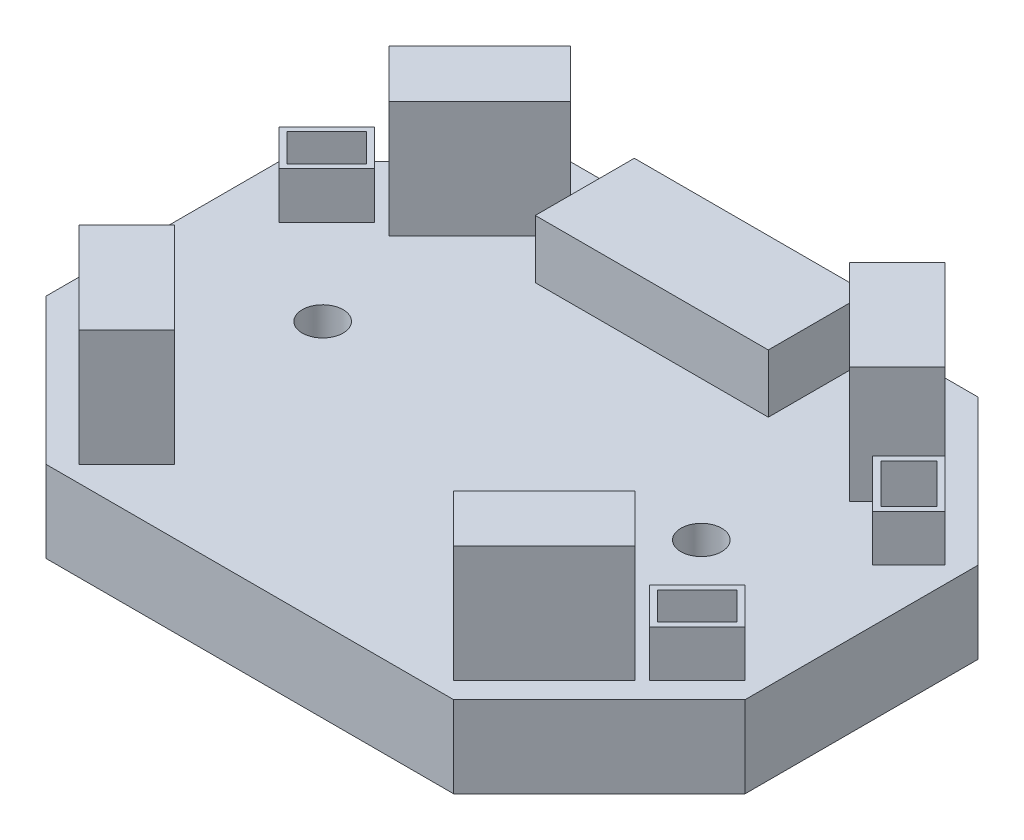
from build123d import *

# Parameters (mm, degrees)
SKETCH_1_R          = 1.75
SKETCH_1_W          = 20
SKETCH_1_H          = 8.5
EXTRUDE_1_DEPTH     = 7
EXTRUDE_2_DEPTH     = 17
EXTRUDE_3_DEPTH     = 11
SKETCH_1_4_W        = 20
SKETCH_1_4_H        = 8.5
EXTRUDE_4_DEPTH     = 12
SHELL_START         = 0.5
SHELL_4_OUTLINE_R   = 2.25
SHELL_4_DEPTH       = 6
SHELL_START_2       = 6.5
SHELL_4_2_DEPTH     = 10
SHELL_4_3_OUTLINE_W = 19
SHELL_4_3_OUTLINE_H = 8
SHELL_4_3_DEPTH     = 5


# Read off the part's stored shape, not the designer's step: 抽壳4
with BuildPart() as part:
    # 草图1 → 凸台-拉伸1 (new body)
    with BuildSketch(Plane(origin=(0, 0, 0), x_dir=(1, 0, 0), z_dir=(0, 1, 0))):
        Polygon((0, 0), (35, 0), (47.5, -12.5), (47.5, -32.5), (35, -45), (0, -45), (-12.5, -32.5), (-12.5, -12.5), align=None)
        with Locations(Location((33.75, -22.5, 0), (0, 0, 270))):
            Circle(SKETCH_1_R, mode=Mode.SUBTRACT)
        with Locations(Location((1.25, -22.5, 0), (0, 0, 90))):
            Circle(SKETCH_1_R, mode=Mode.SUBTRACT)
        Polygon((33.585786438, -43.585786438), (41.363961031, -35.807611845), (37.2627417, -31.706392514), (29.484567107, -39.484567107), align=None, mode=Mode.SUBTRACT)
        Polygon((46.085786438, -31.085786438), (41.984567107, -35.187005769), (38.87329727, -32.075735931), (42.9745166, -27.9745166), align=None, mode=Mode.SUBTRACT)
        Polygon((33.585786438, -1.414213562), (41.363961031, -9.192388155), (37.2627417, -13.293607486), (29.484567107, -5.515432893), align=None, mode=Mode.SUBTRACT)
        Polygon((46.085786438, -13.914213562), (41.984567107, -9.812994231), (38.87329727, -12.924264069), (42.9745166, -17.0254834), align=None, mode=Mode.SUBTRACT)
        Polygon((-7.9745166, -17.0254834), (-11.085786438, -13.914213562), (-6.984567107, -9.812994231), (-3.87329727, -12.924264069), align=None, mode=Mode.SUBTRACT)
        Polygon((5.515432893, -5.515432893), (1.414213562, -1.414213562), (-6.363961031, -9.192388155), (-2.2627417, -13.293607486), align=None, mode=Mode.SUBTRACT)
        Polygon((-11.085786438, -31.085786438), (-6.984567107, -35.187005769), (-3.87329727, -32.075735931), (-7.9745166, -27.9745166), align=None, mode=Mode.SUBTRACT)
        Polygon((-6.363961031, -35.807611845), (-2.2627417, -31.706392514), (5.515432893, -39.484567107), (1.414213562, -43.585786438), align=None, mode=Mode.SUBTRACT)
        with Locations((17.5, -6.25)):
            Rectangle(SKETCH_1_W, SKETCH_1_H, mode=Mode.SUBTRACT)
    extrude(amount=EXTRUDE_1_DEPTH)

    # 草图1<2> → 凸台-拉伸2 (add)
    with BuildSketch(Plane(origin=(0, 0, 0), x_dir=(1, 0, 0), z_dir=(0, 1, 0))):
        Polygon((37.2627417, -13.293607486), (29.484567107, -5.515432893), (33.585786438, -1.414213562), (41.363961031, -9.192388155), align=None)
        Polygon((-6.363961031, -9.192388155), (-2.2627417, -13.293607486), (5.515432893, -5.515432893), (1.414213562, -1.414213562), align=None)
        Polygon((-2.2627417, -31.706392514), (5.515432893, -39.484567107), (1.414213562, -43.585786438), (-6.363961031, -35.807611845), align=None)
        Polygon((37.2627417, -31.706392514), (29.484567107, -39.484567107), (33.585786438, -43.585786438), (41.363961031, -35.807611845), align=None)
    extrude(amount=EXTRUDE_2_DEPTH)

    # 草图1<3> → 凸台-拉伸3 (add)
    with BuildSketch(Plane(origin=(0, 0, 0), x_dir=(1, 0, 0), z_dir=(0, 1, 0))):
        Polygon((-11.085786438, -31.085786438), (-6.984567107, -35.187005769), (-3.87329727, -32.075735931), (-7.9745166, -27.9745166), align=None)
        Polygon((42.9745166, -27.9745166), (46.085786438, -31.085786438), (41.984567107, -35.187005769), (38.87329727, -32.075735931), align=None)
        Polygon((41.984567107, -9.812994231), (38.87329727, -12.924264069), (42.9745166, -17.0254834), (46.085786438, -13.914213562), align=None)
        Polygon((-6.984567107, -9.812994231), (-3.87329727, -12.924264069), (-7.9745166, -17.0254834), (-11.085786438, -13.914213562), align=None)
    extrude(amount=EXTRUDE_3_DEPTH)

    # 草图1<4> → 凸台-拉伸4 (add)
    with BuildSketch(Plane(origin=(0, 0, 0), x_dir=(1, 0, 0), z_dir=(0, 1, 0))):
        with Locations((17.5, -6.25)):
            Rectangle(SKETCH_1_4_W, SKETCH_1_4_H)
    extrude(amount=EXTRUDE_4_DEPTH)

    # 抽壳4 outline → 抽壳4 (cut)
    with BuildSketch(Plane(origin=(0, 0, 0), x_dir=(1, 0, 0), z_dir=(0, 1, 0)).offset(SHELL_START)):
        Polygon((0.207106781, -0.5), (-12, -12.707106781), (-12, -32.292893219), (0.207106781, -44.5), (34.792893219, -44.5), (47, -32.292893219), (47, -12.707106781), (34.792893219, -0.5), align=None)
        with Locations((1.25, -22.5)):
            Circle(SHELL_4_OUTLINE_R, mode=Mode.SUBTRACT)
        with Locations((33.75, -22.5)):
            Circle(SHELL_4_OUTLINE_R, mode=Mode.SUBTRACT)
    extrude(amount=SHELL_4_DEPTH, mode=Mode.SUBTRACT)

    # Shell 4 2 outline → Shell 4 2 (cut)
    with BuildSketch(Plane(origin=(0, 0, 0), x_dir=(1, 0, 0), z_dir=(0, 1, 0)).offset(SHELL_START_2)):
        Polygon((33.585786438, -2.121320344), (30.191673888, -5.515432893), (37.2627417, -12.586500705), (40.656854249, -9.192388155), align=None)
        Polygon((45.378679656, -13.914213562), (41.984567107, -10.520101013), (39.580404051, -12.924264069), (42.9745166, -16.318376618), align=None)
        Polygon((-5.656854249, -9.192388155), (-2.2627417, -12.586500705), (4.808326112, -5.515432893), (1.414213562, -2.121320344), align=None)
        Polygon((-4.580404051, -12.924264069), (-6.984567107, -10.520101013), (-10.378679656, -13.914213562), (-7.9745166, -16.318376618), align=None)
        Polygon((4.808326112, -39.484567107), (-2.2627417, -32.413499295), (-5.656854249, -35.807611845), (1.414213562, -42.878679656), align=None)
        Polygon((-10.378679656, -31.085786438), (-6.984567107, -34.479898987), (-4.580404051, -32.075735931), (-7.9745166, -28.681623382), align=None)
        Polygon((37.2627417, -32.413499295), (30.191673888, -39.484567107), (33.585786438, -42.878679656), (40.656854249, -35.807611845), align=None)
        Polygon((39.580404051, -32.075735931), (41.984567107, -34.479898987), (45.378679656, -31.085786438), (42.9745166, -28.681623382), align=None)
    extrude(amount=SHELL_4_2_DEPTH, mode=Mode.SUBTRACT)

    # Shell 4 3 outline → Shell 4 3 (cut)
    with BuildSketch(Plane(origin=(0, 0, 0), x_dir=(1, 0, 0), z_dir=(0, 1, 0)).offset(SHELL_START_2)):
        with Locations((17.5, -6)):
            Rectangle(SHELL_4_3_OUTLINE_W, SHELL_4_3_OUTLINE_H)
    extrude(amount=SHELL_4_3_DEPTH, mode=Mode.SUBTRACT)


solid = part.part
